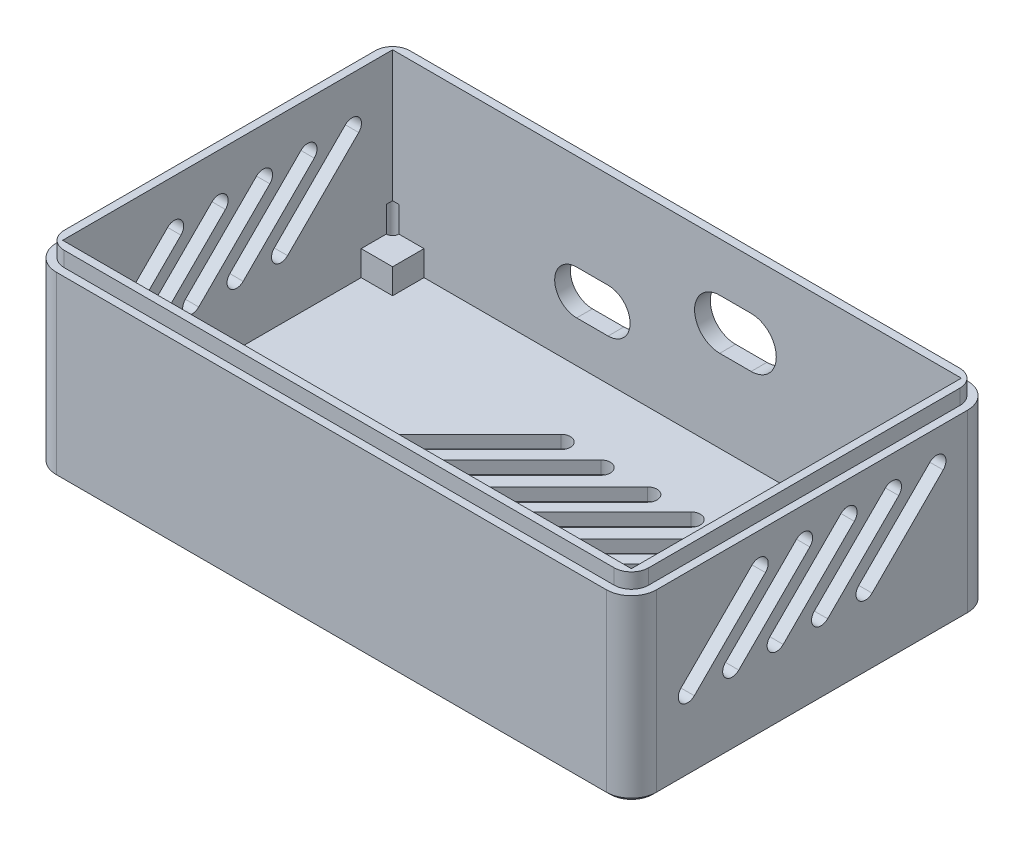
from build123d import *

# Parameters (mm, degrees)
CUERPO_DEPTH                  = 28.5
CROQUIS_HUECO_PCB_W           = 90.5
CROQUIS_HUECO_PCB_H           = 52.5
HUECO_PCB_DEPTH               = 26.5
CROQUIS_LABIO_W               = 90.5
CROQUIS_LABIO_H               = 52.5
LABIO_LIP_DEPTH               = 2.4
CROQUIS_APOYOS_W              = 5
CROQUIS_APOYOS_H              = 5
APOYOS_PCB_DEPTH              = 4
CROQUIS_ALIVIOS_R             = 1
ALIVIOS_ESQUINAS_DEPTH        = 8.1
SALIDAS_USB_Y_PANEL_DEPTH     = 64.729388825
VENTILAS_LATERALES_DEPTH      = 64.729388825
VENTILAS_LATERALES_DEPTH_BACK = 64.729388825
REJILLA_PISO_DEPTH            = 2
CHAFLAN_BASE_SIZE             = 0.6


with BuildPart() as part:
    # Croquis_contorno → Cuerpo (new body)
    with BuildSketch(Plane(origin=(0, 0, 0), x_dir=(1, 0, 0), z_dir=(0, 1, 0))):
        with BuildLine():
            Line((-43.75, -28.75), (43.75, -28.75))
            ThreePointArc((43.75, -28.75), (46.578427125, -27.578427125), (47.75, -24.75))
            Line((47.75, -24.75), (47.75, 24.75))
            ThreePointArc((47.75, 24.75), (46.578427125, 27.578427125), (43.75, 28.75))
            Line((43.75, 28.75), (-43.75, 28.75))
            ThreePointArc((-43.75, 28.75), (-46.578427125, 27.578427125), (-47.75, 24.75))
            Line((-47.75, 24.75), (-47.75, -24.75))
            ThreePointArc((-47.75, -24.75), (-46.578427125, -27.578427125), (-43.75, -28.75))
        make_face()
    extrude(amount=CUERPO_DEPTH)

    # Croquis_hueco_PCB → Hueco_PCB (cut)
    with BuildSketch(Plane(origin=(0, 28.5, 0), x_dir=(1, 0, 0), z_dir=(0, 1, 0))):
        Rectangle(CROQUIS_HUECO_PCB_W, CROQUIS_HUECO_PCB_H)
    extrude(amount=-HUECO_PCB_DEPTH, mode=Mode.SUBTRACT)

    # Croquis_labio → Labio_lip (add)
    with BuildSketch(Plane(origin=(0, 28.5, 0), x_dir=(1, 0, 0), z_dir=(0, 1, 0))):
        with BuildLine():
            Line((-43.75, -27.5), (43.75, -27.5))
            ThreePointArc((43.75, -27.5), (45.694543648, -26.694543648), (46.5, -24.75))
            Line((46.5, -24.75), (46.5, 24.75))
            ThreePointArc((46.5, 24.75), (45.694543648, 26.694543648), (43.75, 27.5))
            Line((43.75, 27.5), (-43.75, 27.5))
            ThreePointArc((-43.75, 27.5), (-45.694543648, 26.694543648), (-46.5, 24.75))
            Line((-46.5, 24.75), (-46.5, -24.75))
            ThreePointArc((-46.5, -24.75), (-45.694543648, -26.694543648), (-43.75, -27.5))
        make_face()
        Rectangle(CROQUIS_LABIO_W, CROQUIS_LABIO_H, mode=Mode.SUBTRACT)
    extrude(amount=LABIO_LIP_DEPTH)

    # Croquis_apoyos → Apoyos_PCB (add)
    with BuildSketch(Plane(origin=(0, 2, 0), x_dir=(1, 0, 0), z_dir=(0, 1, 0))):
        with Locations((-42.75, -23.75)):
            Rectangle(CROQUIS_APOYOS_W, CROQUIS_APOYOS_H)
        with Locations((-42.75, 23.75)):
            Rectangle(CROQUIS_APOYOS_W, CROQUIS_APOYOS_H)
        with Locations((42.75, -23.75)):
            Rectangle(CROQUIS_APOYOS_W, CROQUIS_APOYOS_H)
        with Locations((42.75, 23.75)):
            Rectangle(CROQUIS_APOYOS_W, CROQUIS_APOYOS_H)
    extrude(amount=APOYOS_PCB_DEPTH)

    # Croquis_alivios → Alivios_esquinas (cut)
    with BuildSketch(Plane(origin=(0, 2, 0), x_dir=(1, 0, 0), z_dir=(0, 1, 0))):
        with Locations((-45.25, -26.25)):
            Circle(CROQUIS_ALIVIOS_R)
        with Locations((-45.25, 26.25)):
            Circle(CROQUIS_ALIVIOS_R)
        with Locations((45.25, -26.25)):
            Circle(CROQUIS_ALIVIOS_R)
        with Locations((45.25, 26.25)):
            Circle(CROQUIS_ALIVIOS_R)
    extrude(amount=ALIVIOS_ESQUINAS_DEPTH, mode=Mode.SUBTRACT)

    # Croquis_salidas → Salidas_USB_y_panel (cut, through all)
    with BuildSketch(Plane.XY):
        with BuildLine():
            Line((6.8, 23.1), (11.8, 23.1))
            ThreePointArc((11.8, 23.1), (15.8, 19.1), (11.8, 15.1))
            Line((11.8, 15.1), (6.8, 15.1))
            ThreePointArc((6.8, 15.1), (2.8, 19.1), (6.8, 23.1))
        make_face()
        with BuildLine():
            Line((-15.96, 15.6), (-10.96, 15.6))
            ThreePointArc((-10.96, 15.6), (-7.46, 12.1), (-10.96, 8.6))
            Line((-10.96, 8.6), (-15.96, 8.6))
            ThreePointArc((-15.96, 8.6), (-19.46, 12.1), (-15.96, 15.6))
        make_face()
    extrude(amount=-SALIDAS_USB_Y_PANEL_DEPTH, mode=Mode.SUBTRACT)

    # Croquis_ventilas → Ventilas_laterales (cut, two sides: drawn at the far end of the back side and taken through both)
    with BuildSketch(Plane(origin=(0, 0, 0), x_dir=(0, 0, -1), z_dir=(1, 0, 0)).offset(-VENTILAS_LATERALES_DEPTH_BACK)):
        with BuildLine():
            Line((-20.859650045, 13.003805922), (-9.545941546, 24.317514421))
            ThreePointArc((-9.545941546, 24.317514421), (-7.424621202, 24.317514421), (-7.424621202, 22.196194078))
            Line((-7.424621202, 22.196194078), (-18.738329701, 10.882485579))
            ThreePointArc((-18.738329701, 10.882485579), (-20.859650045, 10.882485579), (-20.859650045, 13.003805922))
        make_face()
        with BuildLine():
            Line((-13.788582233, 13.003805922), (-2.474873734, 24.317514421))
            ThreePointArc((-2.474873734, 24.317514421), (-0.353553391, 24.317514421), (-0.353553391, 22.196194078))
            Line((-0.353553391, 22.196194078), (-11.66726189, 10.882485579))
            ThreePointArc((-11.66726189, 10.882485579), (-13.788582233, 10.882485579), (-13.788582233, 13.003805922))
        make_face()
        with BuildLine():
            Line((-6.717514421, 13.003805922), (4.596194078, 24.317514421))
            ThreePointArc((4.596194078, 24.317514421), (6.717514421, 24.317514421), (6.717514421, 22.196194078))
            Line((6.717514421, 22.196194078), (-4.596194078, 10.882485579))
            ThreePointArc((-4.596194078, 10.882485579), (-6.717514421, 10.882485579), (-6.717514421, 13.003805922))
        make_face()
        with BuildLine():
            Line((0.353553391, 13.003805922), (11.66726189, 24.317514421))
            ThreePointArc((11.66726189, 24.317514421), (13.788582233, 24.317514421), (13.788582233, 22.196194078))
            Line((13.788582233, 22.196194078), (2.474873734, 10.882485579))
            ThreePointArc((2.474873734, 10.882485579), (0.353553391, 10.882485579), (0.353553391, 13.003805922))
        make_face()
        with BuildLine():
            Line((7.424621202, 13.003805922), (18.738329701, 24.317514421))
            ThreePointArc((18.738329701, 24.317514421), (20.859650045, 24.317514421), (20.859650045, 22.196194078))
            Line((20.859650045, 22.196194078), (9.545941546, 10.882485579))
            ThreePointArc((9.545941546, 10.882485579), (7.424621202, 10.882485579), (7.424621202, 13.003805922))
        make_face()
    extrude(amount=VENTILAS_LATERALES_DEPTH + VENTILAS_LATERALES_DEPTH_BACK, mode=Mode.SUBTRACT)

    # Croquis_rejilla_piso → Rejilla_piso (cut)
    with BuildSketch(Plane(origin=(0, 0, 0), x_dir=(1, 0, 0), z_dir=(0, 1, 0))):
        with BuildLine():
            Line((-36.769552622, -13.435028843), (-7.778174593, 15.556349186))
            ThreePointArc((-7.778174593, 15.556349186), (-5.656854249, 15.556349186), (-5.656854249, 13.435028843))
            Line((-5.656854249, 13.435028843), (-34.648232278, -15.556349186))
            ThreePointArc((-34.648232278, -15.556349186), (-36.769552622, -15.556349186), (-36.769552622, -13.435028843))
        make_face()
        with BuildLine():
            Line((-29.69848481, -13.435028843), (-1.060660172, 15.202795796))
            ThreePointArc((-1.060660172, 15.202795796), (1.060660172, 15.202795796), (1.060660172, 13.081475452))
            Line((1.060660172, 13.081475452), (-27.577164466, -15.556349186))
            ThreePointArc((-27.577164466, -15.556349186), (-29.69848481, -15.556349186), (-29.69848481, -13.435028843))
        make_face()
        with BuildLine():
            Line((-22.273863607, -13.435028843), (6.363961031, 15.202795796))
            ThreePointArc((6.363961031, 15.202795796), (8.485281374, 15.202795796), (8.485281374, 13.081475452))
            Line((8.485281374, 13.081475452), (-20.152543264, -15.556349186))
            ThreePointArc((-20.152543264, -15.556349186), (-22.273863607, -15.556349186), (-22.273863607, -13.435028843))
        make_face()
        with BuildLine():
            Line((-15.379572491, -13.435028843), (13.258252147, 15.202795796))
            ThreePointArc((13.258252147, 15.202795796), (15.379572491, 15.202795796), (15.379572491, 13.081475452))
            Line((15.379572491, 13.081475452), (-13.258252147, -15.556349186))
            ThreePointArc((-13.258252147, -15.556349186), (-15.379572491, -15.556349186), (-15.379572491, -13.435028843))
        make_face()
        with BuildLine():
            Line((-7.954951288, -13.435028843), (20.68287335, 15.202795796))
            ThreePointArc((20.68287335, 15.202795796), (22.804193693, 15.202795796), (22.804193693, 13.081475452))
            Line((22.804193693, 13.081475452), (-5.833630945, -15.556349186))
            ThreePointArc((-5.833630945, -15.556349186), (-7.954951288, -15.556349186), (-7.954951288, -13.435028843))
        make_face()
        with BuildLine():
            Line((-1.060660172, -13.435028843), (27.577164466, 15.202795796))
            ThreePointArc((27.577164466, 15.202795796), (29.69848481, 15.202795796), (29.69848481, 13.081475452))
            Line((29.69848481, 13.081475452), (1.060660172, -15.556349186))
            ThreePointArc((1.060660172, -15.556349186), (-1.060660172, -15.556349186), (-1.060660172, -13.435028843))
        make_face()
        with BuildLine():
            Line((5.303300859, -13.435028843), (34.471455583, 15.733125881))
            ThreePointArc((34.471455583, 15.733125881), (36.592775926, 15.733125881), (36.592775926, 13.611805538))
            Line((36.592775926, 13.611805538), (7.424621202, -15.556349186))
            ThreePointArc((7.424621202, -15.556349186), (5.303300859, -15.556349186), (5.303300859, -13.435028843))
        make_face()
    extrude(amount=REJILLA_PISO_DEPTH, mode=Mode.SUBTRACT)

    # Chaflan_base
    chaflan_base_edges = [part.edges().sort_by_distance(p)[0] for p in [
        (0, 0, 28.75),
        (46.578427125, 0, 27.578427125),
        (47.75, 0, 0),
        (46.578427125, 0, -27.578427125),
        (0, 0, -28.75),
        (-46.578427125, 0, -27.578427125),
        (-47.75, 0, 0),
        (-46.578427125, 0, 27.578427125),
    ]]
    chamfer(chaflan_base_edges, length=CHAFLAN_BASE_SIZE)


solid = part.part
